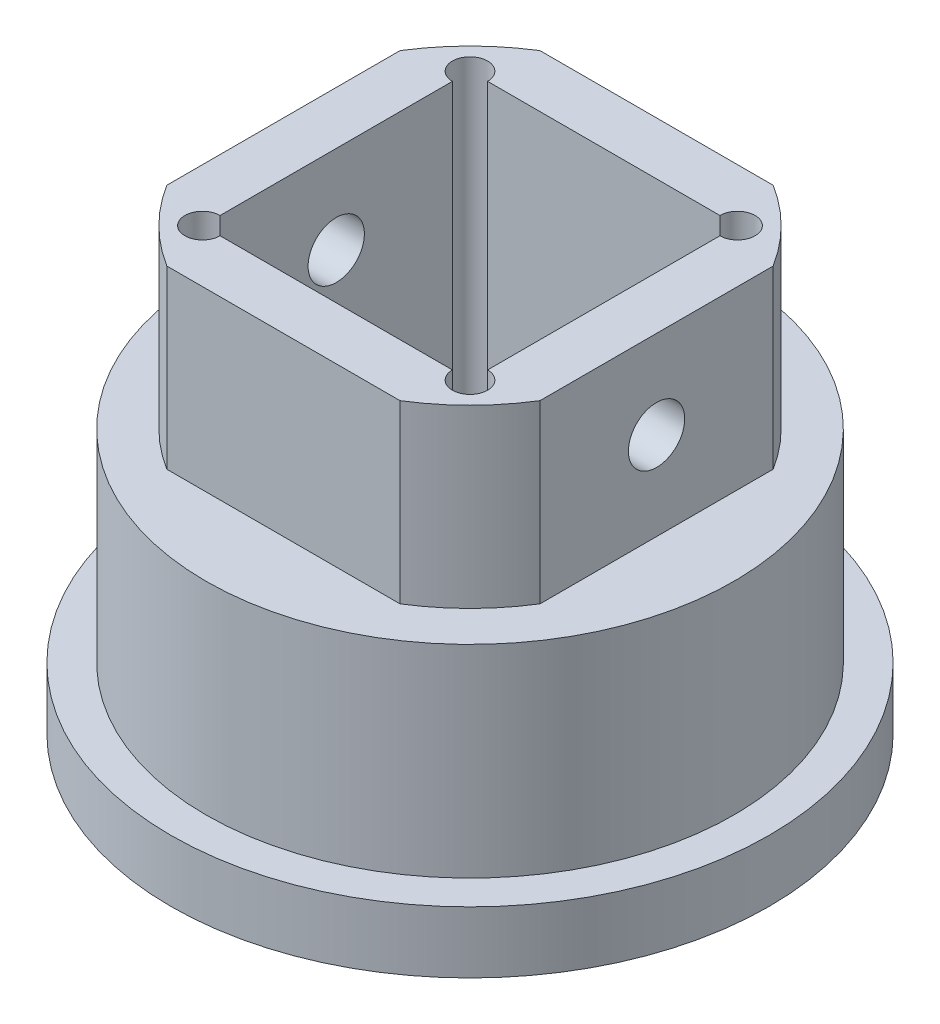
from build123d import *

# Parameters (mm, degrees)
SKETCH_1_R          = 12.5
EXTRUDE_1_DEPTH     = 7.5
EXTRUDE_2_DEPTH     = 10
EXTRUDE_START       = -3
SKETCH_3_R          = 17
SKETCH_3_R_2        = 12.5
EXTRUDE_3_DEPTH     = 3
SKETCH_4_R          = 2.1000000000000005
CUT_EXTRUDE_1_DEPTH = 37.83761664386012
SKETCH_5_R          = 1.6000000000000003
CUT_EXTRUDE_2_DEPTH = 37.83761664386012
CUT_EXTRUDE_START   = -10
CUT_EXTRUDE_3_DEPTH = 10
SKETCH_7_R          = 17
SKETCH_7_R_2        = 12.500000000000004
EXTRUDE_4_DEPTH     = 0.5
SKETCH_8_R          = 15
SKETCH_8_R_2        = 12.499999999999996
EXTRUDE_5_DEPTH     = 11.5


# Read off the part's stored shape, not the designer's step: 凸台-拉伸2
with BuildPart() as part:
    # 草图1 → 凸台-拉伸1 (new, symmetric)
    with BuildSketch(Plane(origin=(0, 0, 0), x_dir=(1, 0, 0), z_dir=(0, 1, 0))):
        with Locations(Location((-1.39e-15, 1.39e-15, 0), (0, 0, 270))):
            Circle(SKETCH_1_R)
        with BuildLine():
            Line((6.600000000000003, -7.6000000000000005), (-6.599999999999996, -7.6000000000000005))
            ThreePointArc((-6.599999999999996, -7.6000000000000005), (-8.30710678118655, -8.307106781186542), (-7.599999999999978, -6.6000000000000005))
            Line((-7.599999999999996, -6.6000000000000005), (-7.599999999999996, 6.599999999999999))
            ThreePointArc((-7.599999999999978, 6.599999999999999), (-8.30710678118655, 8.30710678118654), (-6.599999999999996, 7.599999999999999))
            Line((-6.599999999999996, 7.599999999999999), (6.600000000000003, 7.599999999999999))
            ThreePointArc((6.600000000000002, 7.599999999999999), (7.600000000000003, 8.6), (8.600000000000005, 7.599999999999999))
            ThreePointArc((8.600000000000005, 7.599999999999999), (8.307106781186558, 6.892893218813457), (7.600000000000021, 6.599999999999998))
            Line((7.600000000000003, 6.599999999999999), (7.600000000000003, -6.6))
            ThreePointArc((7.600000000000021, -6.6), (8.307106781186558, -6.892893218813459), (8.600000000000003, -7.6000000000000005))
            ThreePointArc((8.600000000000003, -7.6000000000000005), (7.600000000000003, -8.600000000000001), (6.600000000000002, -7.6000000000000005))
        make_face(mode=Mode.SUBTRACT)
    extrude(amount=EXTRUDE_1_DEPTH, both=True)

    # 凸台-拉伸2 outline → 凸台-拉伸2 (add)
    with BuildSketch(Plane.XZ.offset(7.5)):
        with BuildLine():
            Line((10.6, -6.62495283), (10.6, 6.62495283))
            ThreePointArc((10.6, 6.62495283), (8.838834765, 8.838834765), (6.62495283, 10.6))
            Line((6.62495283, 10.6), (-6.62495283, 10.6))
            ThreePointArc((-6.62495283, 10.6), (-8.838834765, 8.838834765), (-10.6, 6.62495283))
            Line((-10.6, 6.62495283), (-10.6, -6.62495283))
            ThreePointArc((-10.6, -6.62495283), (-8.838834765, -8.838834765), (-6.62495283, -10.6))
            Line((-6.62495283, -10.6), (6.62495283, -10.6))
            ThreePointArc((6.62495283, -10.6), (8.838834765, -8.838834765), (10.6, -6.62495283))
        make_face()
        with BuildLine():
            ThreePointArc((-6.6, -7.6), (-8.307106781, -8.307106781), (-7.6, -6.6))
            Line((-7.6, -6.6), (-7.6, 6.6))
            ThreePointArc((-7.6, 6.6), (-8.307106781, 8.307106781), (-6.6, 7.6))
            Line((-6.6, 7.6), (6.6, 7.6))
            ThreePointArc((6.6, 7.6), (8.307106781, 8.307106781), (7.6, 6.6))
            Line((7.6, 6.6), (7.6, -6.6))
            ThreePointArc((7.6, -6.6), (8.307106781, -8.307106781), (6.6, -7.6))
            Line((6.6, -7.6), (-6.6, -7.6))
        make_face(mode=Mode.SUBTRACT)
    extrude_2 = extrude(amount=EXTRUDE_2_DEPTH)

    # 镜向1: 凸台-拉伸2 across plane
    add(extrude_2.mirror(Plane.ZX))

    # 草图3 → 凸台-拉伸3 (add)
    with BuildSketch(Plane.XZ.offset(7.5).offset(EXTRUDE_START)):
        with Locations(Location((0, 0, 0), (0, 0, 270))):
            Circle(SKETCH_3_R)
        with Locations(Location((0, 0, 0), (0, 0, 270))):
            Circle(SKETCH_3_R_2, mode=Mode.SUBTRACT)
    extrude(amount=EXTRUDE_3_DEPTH)

    # 草图4 → 切除-拉伸1 (cut, through all)
    with BuildSketch(Plane.XY.offset(10.600000000000001)):
        with Locations((-8.7e-16, -12.5)):
            Circle(SKETCH_4_R)
    extrude(amount=-CUT_EXTRUDE_1_DEPTH, mode=Mode.SUBTRACT)

    # 草图5 → 切除-拉伸2 (cut, through all)
    with BuildSketch(Plane(origin=(10.6, 0, 0), x_dir=(0, 0, -1), z_dir=(1, 0, 0))):
        with Locations((1.73e-15, 12.5)):
            Circle(SKETCH_5_R)
    extrude(amount=-CUT_EXTRUDE_2_DEPTH, mode=Mode.SUBTRACT)

    # 草图6 → 切除-拉伸3 (cut)
    with BuildSketch(Plane.XZ.offset(17.5).offset(CUT_EXTRUDE_START)):
        with BuildLine():
            Line((10.599999999999996, -6.624952830020757), (10.6, 6.624952830020752))
            ThreePointArc((10.6, 6.624952830020752), (8.83883476483184, 8.838834764831846), (6.6249528300207485, 10.600000000000001))
            Line((6.6249528300207485, 10.600000000000001), (-6.624952830020753, 10.600000000000001))
            ThreePointArc((-6.624952830020753, 10.600000000000001), (-8.838834764831846, 8.838834764831844), (-10.6, 6.624952830020758))
            Line((-10.6, 6.624952830020758), (-10.6, -6.624952830020761))
            ThreePointArc((-10.6, -6.624952830020761), (-8.83883476483185, -8.838834764831843), (-6.624952830020767, -10.599999999999994))
            Line((-6.624952830020767, -10.599999999999994), (6.624952830020759, -10.599999999999998))
            ThreePointArc((6.624952830020759, -10.599999999999998), (8.838834764831844, -8.838834764831844), (10.599999999999996, -6.624952830020757))
        make_face()
    extrude(amount=CUT_EXTRUDE_3_DEPTH, mode=Mode.SUBTRACT)

    # 草图7 → 凸台-拉伸4 (add)
    with BuildSketch(Plane(origin=(0, -4.5, 0), x_dir=(1, 0, 0), z_dir=(0, 1, 0))):
        with Locations(Location((0, 0, 0), (0, 0, 90))):
            Circle(SKETCH_7_R)
        with Locations(Location((0, 0, 0), (0, 0, 122.005199861))):
            Circle(SKETCH_7_R_2, mode=Mode.SUBTRACT)
    extrude(amount=EXTRUDE_4_DEPTH)

    # 草图8 → 凸台-拉伸5 (add)
    with BuildSketch(Plane(origin=(0, -4, 0), x_dir=(1, 0, 0), z_dir=(0, 1, 0))):
        with Locations(Location((0, 0, 0), (0, 0, 270))):
            Circle(SKETCH_8_R)
        Circle(SKETCH_8_R_2, mode=Mode.SUBTRACT)
    extrude(amount=EXTRUDE_5_DEPTH)


solid = part.part
